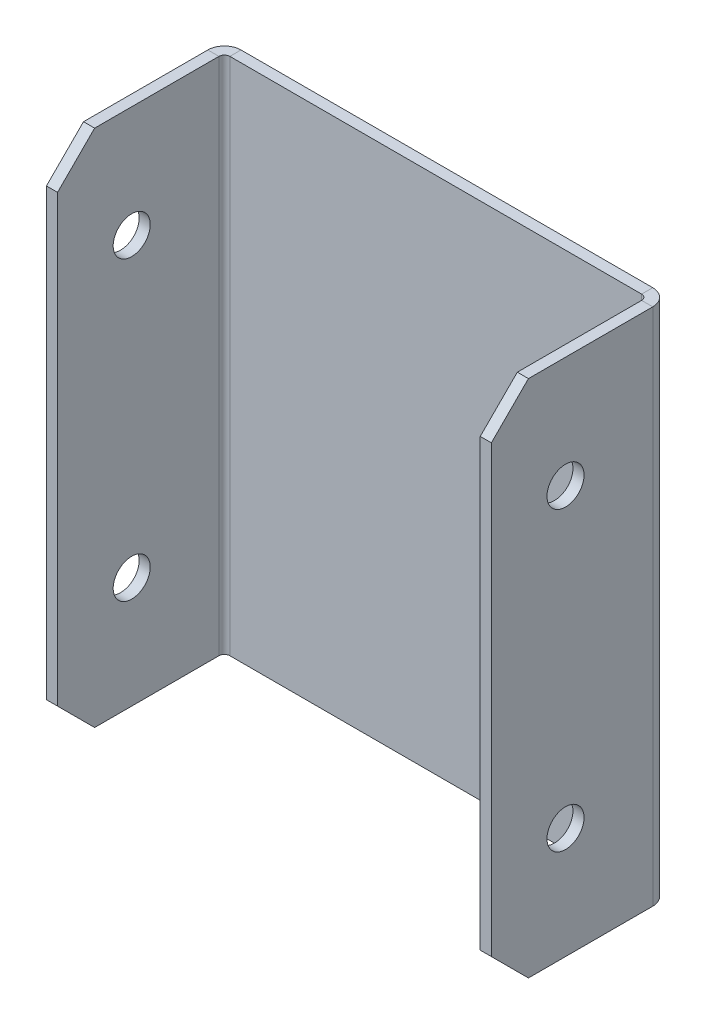
from build123d import *

# Parameters (mm, degrees)
CROQUIS1_W                         = 60
CROQUIS1_H                         = 70
BRIDA_BASE1_DEPTH                  = 1.5
BRIDA_DE_ARISTA1_STRIP_W           = 7.4732
BRIDA_DE_ARISTA1_STRIP_H           = 1.5
BRIDA_DE_ARISTA1_STRIP_CUT_DEPTH   = 70
BRIDA_DE_ARISTA1_STRIP_2_W         = 7.4732
BRIDA_DE_ARISTA1_STRIP_2_H         = 1.5
BRIDA_DE_ARISTA1_STRIP_CUT_2_DEPTH = 70
BRIDA_DE_ARISTA1_DEPTH             = 70
BRIDA_DE_ARISTA1_BEND_DEPTH        = 70
ROMPER_START                       = -40.658639918
ROMPER_ESQUINA1_OUTLINE_W          = 64
ROMPER_ESQUINA1_OUTLINE_H          = 51.123106012
ROMPER_ESQUINA1_DEPTH              = 3.535533906
ROMPER_START_2                     = 5.303300859
ROMPER_ESQUINA1_2_OUTLINE_W        = 64
ROMPER_ESQUINA1_2_OUTLINE_H        = 3.876893988
ROMPER_ESQUINA1_2_DEPTH            = 7.071067812
CROQUIS16_R                        = 2.5
CORTAR_EXTRUIR1_DEPTH              = 74.015409333


# Read off the part's stored shape, not the designer's step: Romper esquina1
# Sheet-metal steps are written as plain solids
with BuildPart() as part:
    # Croquis1 → Brida base1 (new body)
    with BuildSketch(Plane.XY):
        Rectangle(CROQUIS1_W, CROQUIS1_H)
    extrude(amount=-BRIDA_BASE1_DEPTH)

    # Brida de arista1 strip (across the edge) → Brida de arista1 strip cut (cut)
    with BuildSketch(Plane(origin=(-30, 35, 0), x_dir=(1, 0, 0), z_dir=(0, -1, 0))):
        with Locations((-1.5, -0.75)):
            Rectangle(BRIDA_DE_ARISTA1_STRIP_W, BRIDA_DE_ARISTA1_STRIP_H)
    extrude(amount=BRIDA_DE_ARISTA1_STRIP_CUT_DEPTH, mode=Mode.SUBTRACT)

    # Brida de arista1 strip 2 (across the edge) → Brida de arista1 strip cut 2 (cut)
    with BuildSketch(Plane(origin=(30, -35, 0), x_dir=(-1, 0, 0), z_dir=(0, 1, 0))):
        with Locations((-1.5, -0.75)):
            Rectangle(BRIDA_DE_ARISTA1_STRIP_2_W, BRIDA_DE_ARISTA1_STRIP_2_H)
    extrude(amount=BRIDA_DE_ARISTA1_STRIP_CUT_2_DEPTH, mode=Mode.SUBTRACT)

    # Brida de arista1 section (across the edge) → Brida de arista1 (add)
    with BuildSketch(Plane(origin=(-30, 35, 0), x_dir=(1, 0, 0), z_dir=(0, -1, 0))):
        with BuildLine():
            Line((0, 0.7366), (0, 22.5))
            Line((0, 22.5), (1.5, 22.5))
            Line((1.5, 22.5), (1.5, 0.7366))
            ThreePointArc((1.5, 0.7366), (1.715745145, 0.215745145), (2.2366, 0))
            Line((2.2366, 0), (2.2366, -1.5))
            ThreePointArc((2.2366, -1.5), (0.655084973, -0.844915027), (0, 0.7366))
        make_face()
    extrude(amount=BRIDA_DE_ARISTA1_DEPTH)

    # Brida de arista1 section 2 (across the edge) → Brida de arista1 bend (add)
    with BuildSketch(Plane(origin=(30, -35, 0), x_dir=(-1, 0, 0), z_dir=(0, 1, 0))):
        with BuildLine():
            Line((0, 0.7366), (0, 22.5))
            Line((0, 22.5), (1.5, 22.5))
            Line((1.5, 22.5), (1.5, 0.7366))
            ThreePointArc((1.5, 0.7366), (1.715745145, 0.215745145), (2.2366, 0))
            Line((2.2366, 0), (2.2366, -1.5))
            ThreePointArc((2.2366, -1.5), (0.655084973, -0.844915027), (0, 0.7366))
        make_face()
    extrude(amount=BRIDA_DE_ARISTA1_BEND_DEPTH)

    # Romper esquina1 outline → Romper esquina1 (cut)
    with BuildSketch(Plane(origin=(0, 0, 0), x_dir=(1, 0, 0), z_dir=(0, 0.707106781186548, -0.707106781186547)).offset(ROMPER_START)):
        with Locations((0, -11.561553006)):
            Rectangle(ROMPER_ESQUINA1_OUTLINE_W, ROMPER_ESQUINA1_OUTLINE_H)
    extrude(amount=ROMPER_ESQUINA1_DEPTH, mode=Mode.SUBTRACT)

    # Romper esquina1 2 outline → Romper esquina1 2 (cut)
    with BuildSketch(Plane(origin=(0, 0, 0), x_dir=(1, 0, 0), z_dir=(0, 0.707106781186548, -0.707106781186547)).offset(ROMPER_START_2)):
        with Locations((0, -39.061553006)):
            Rectangle(ROMPER_ESQUINA1_2_OUTLINE_W, ROMPER_ESQUINA1_2_OUTLINE_H)
    extrude(amount=ROMPER_ESQUINA1_2_DEPTH, mode=Mode.SUBTRACT)

    # Croquis16 → Cortar-Extruir1 (cut, through all)
    with BuildSketch(Plane(origin=(30, 0, 0), x_dir=(0, 0, -1), z_dir=(1, 0, 0))):
        with Locations((-12.5, -20)):
            Circle(CROQUIS16_R)
        with Locations((-12.5, 20)):
            Circle(CROQUIS16_R)
    extrude(amount=-CORTAR_EXTRUIR1_DEPTH, mode=Mode.SUBTRACT)


solid = part.part
